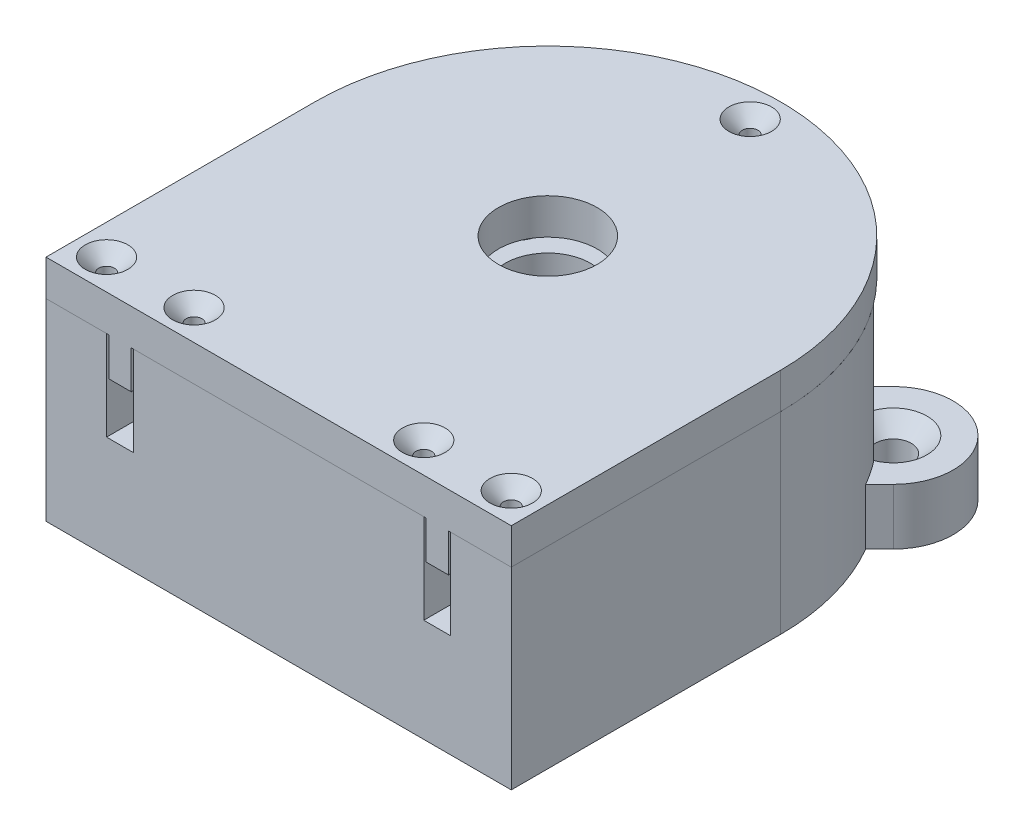
from build123d import *
from build123d.topology import SkipClean

# Parameters (mm, degrees)
BOSS_EXTRUDE1_DEPTH                         = 3.2
SKETCH2_R                                   = 1.25
SKETCH2_R_2                                 = 0.545
BOSS_EXTRUDE2_DEPTH                         = 0.8
BOSS_EXTRUDE2_2_DEPTH                       = 0.8
BOSS_EXTRUDE2_3_DEPTH                       = 0.8
BOSS_EXTRUDE3_START                         = 1
SKETCH4_R                                   = 6.435
BOSS_EXTRUDE3_DEPTH                         = 1
SKETCH5_R                                   = 6.435
BOSS_EXTRUDE4_DEPTH                         = 1
BOSS_EXTRUDE5_START                         = 0.8
SKETCH7_R                                   = 1.25
SKETCH7_R_2                                 = 0.595
BOSS_EXTRUDE5_DEPTH                         = 0.8
BOSS_EXTRUDE6_START                         = -1.5
BOSS_EXTRUDE6_DEPTH                         = 6.1
BOSS_EXTRUDE7_DEPTH                         = 2.5
SKETCH10_R                                  = 10.37
SKETCH10_W                                  = 20.74
SKETCH10_H                                  = 12
BOSS_EXTRUDE8_DEPTH                         = 1.6
CSK_FOR_1_FLAT_HEAD_MACHINE_SCREW_2_COUNT   = 2
CSK_FOR_1_FLAT_HEAD_MACHINE_SCREW_2_PITCH   = 18.04
CSK_FOR_1_FLAT_HEAD_MACHINE_SCREW_3_COUNT   = 2
CSK_FOR_1_FLAT_HEAD_MACHINE_SCREW_3_PITCH   = 14.14
CSK_FOR_1_FLAT_HEAD_MACHINE_SCREW_4_COUNT   = 2
CSK_FOR_1_FLAT_HEAD_MACHINE_SCREW_4_PITCH   = 21.639530956
CSK_FOR_1_FLAT_HEAD_MACHINE_SCREW_5_COUNT   = 2
CSK_FOR_1_FLAT_HEAD_MACHINE_SCREW_5_PITCH   = 3.9
BOSS_EXTRUDE9_DEPTH                         = 2.5
SKETCH26_R                                  = 8.2
CUT_EXTRUDE4_DEPTH                          = 1.5
SKETCH27_R                                  = 2.2
CUT_EXTRUDE5_DEPTH                          = 18.630283605
SKETCH28_R                                  = 1.4
CUT_EXTRUDE6_DEPTH                          = 18.417717991
SKETCH30_R                                  = 6.635
BOSS_EXTRUDE10_DEPTH                        = 2.1
CUT_EXTRUDE3_START                          = -6.1
SKETCH25_R                                  = 1.6
CUT_EXTRUDE3_DEPTH                          = 7.7
CSK_FOR_1_FLAT_HEAD_MACHINE_SCREW_6_A_COUNT = 2
CSK_FOR_1_FLAT_HEAD_MACHINE_SCREW_6_A_PITCH = 7.304924281
CSK_FOR_1_FLAT_HEAD_MACHINE_SCREW_7_COUNT   = 2
CSK_FOR_1_FLAT_HEAD_MACHINE_SCREW_7_PITCH   = 7.304924281
CSK_FOR_1_FLAT_HEAD_MACHINE_SCREW_8_A_COUNT = 2
CSK_FOR_1_FLAT_HEAD_MACHINE_SCREW_8_A_PITCH = 15.4
CSK_FOR_1_FLAT_HEAD_MACHINE_SCREW_9_COUNT   = 2
CSK_FOR_1_FLAT_HEAD_MACHINE_SCREW_9_PITCH   = 21.778888861
CSK_FOR_1_FLAT_HEAD_MACHINE_SCREW_10_COUNT  = 2
CSK_FOR_1_FLAT_HEAD_MACHINE_SCREW_10_PITCH  = 15.4
SKETCH36_R                                  = 7.57
SKETCH36_R_2                                = 6.735
BOSS_EXTRUDE11_DEPTH                        = 1.7
SKETCH37_R                                  = 2.2
CUT_EXTRUDE7_DEPTH                          = 1.6
FILLET1_R                                   = 1


# Read off the part's stored shape, not the designer's step: Boss-Extrude6
with BuildPart() as part:
    # Sketch1 → Boss-Extrude1 (new body)
    with BuildSketch(Plane(origin=(0, 0, 0), x_dir=(1, 0, 0), z_dir=(0, 1, 0))):
        with BuildLine():
            ThreePointArc((-1.284523258, -1.4), (-1.48216338, -1.188777404), (-1.645448267, -0.95))
            Line((-1.645448267, -0.95), (-2.598076211, -1.5))
            ThreePointArc((-2.598076211, -1.5), (-2.379793788, -2.026980386), (-2.305341719, -2.5925))
            ThreePointArc((-2.305341719, -2.5925), (-2.88570421, -4.075525106), (-4.318489055, -4.770731315))
            ThreePointArc((-4.318489055, -4.770731315), (0, -6.435), (4.318489055, -4.770731315))
            ThreePointArc((4.318489055, -4.770731315), (2.556545765, -3.609681503), (2.598076211, -1.5))
            Line((2.598076211, -1.5), (1.645448267, -0.95))
            ThreePointArc((1.645448267, -0.95), (1.48216338, -1.188777404), (1.284523258, -1.4))
            ThreePointArc((1.284523258, -1.4), (0, -1.9), (-1.284523258, -1.4))
        make_face()
        with BuildLine():
            Line((0, 3), (0, 1.9))
            ThreePointArc((0, 1.9), (1.343502884, 1.343502884), (1.9, 0))
            ThreePointArc((1.9, 0), (1.83525907, -0.491756186), (1.645448267, -0.95))
            Line((1.645448267, -0.95), (2.598076211, -1.5))
            ThreePointArc((2.598076211, -1.5), (4.404348764, -0.409192827), (6.290819041, -1.35455557))
            ThreePointArc((6.290819041, -1.35455557), (6.398853238, -0.681103689), (6.435, 0))
            ThreePointArc((6.435, 0), (5.201017615, 3.789279717), (1.972329986, 6.125286885))
            ThreePointArc((1.972329986, 6.125286885), (2.1311694, 5.667018662), (2.185, 5.185))
            ThreePointArc((2.185, 5.185), (1.545028317, 3.639971683), (0, 3))
        make_face()
        with BuildLine():
            ThreePointArc((-1.645448267, -0.95), (-1.645448267, 0.95), (0, 1.9))
            Line((0, 1.9), (0, 3))
            ThreePointArc((0, 3), (-1.847802999, 4.01887433), (-1.972329986, 6.125286885))
            ThreePointArc((-1.972329986, 6.125286885), (-5.572873473, 3.2175), (-6.290819041, -1.35455557))
            ThreePointArc((-6.290819041, -1.35455557), (-4.404348764, -0.409192827), (-2.598076211, -1.5))
            Line((-2.598076211, -1.5), (-1.645448267, -0.95))
        make_face()
        with BuildLine():
            Line((1.284523258, -1.4), (0, -1.4))
            Line((0, -1.4), (-1.284523258, -1.4))
            ThreePointArc((-1.284523258, -1.4), (0, -1.9), (1.284523258, -1.4))
        make_face()
    extrude(amount=BOSS_EXTRUDE1_DEPTH)



with BuildPart() as body_2:
    # Sketch2 → Boss-Extrude2 (new body)
    with BuildSketch(Plane.XZ):
        with Locations(Location((-4.490341719, 2.5925, 0), (0, 0, 270))):
            Circle(SKETCH2_R)
        with Locations(Location((-4.490341719, 2.5925, 0), (0, 0, 270))):
            Circle(SKETCH2_R_2, mode=Mode.SUBTRACT)
    extrude(amount=-BOSS_EXTRUDE2_DEPTH)


with BuildPart() as body_3:
    # Sketch2 → Boss-Extrude2 2 (new body)
    with BuildSketch(Plane.XZ):
        with Locations(Location((4.490341719, 2.5925, 0), (0, 0, 270))):
            Circle(SKETCH2_R)
        with Locations(Location((4.490341719, 2.5925, 0), (0, 0, 270))):
            Circle(SKETCH2_R_2, mode=Mode.SUBTRACT)
    extrude(amount=-BOSS_EXTRUDE2_2_DEPTH)


with BuildPart() as body_4:
    # Sketch2 → Boss-Extrude2 3 (new body)
    with BuildSketch(Plane.XZ):
        with Locations(Location((0, -5.185, 0), (0, 0, 270))):
            Circle(SKETCH2_R)
        with Locations(Location((0, -5.185, 0), (0, 0, 270))):
            Circle(SKETCH2_R_2, mode=Mode.SUBTRACT)
    extrude(amount=-BOSS_EXTRUDE2_3_DEPTH)


with BuildPart() as part_1:
    with SkipClean():  # the faces are left unmerged after this step: merging them gives an invalid solid
        add(part.part)

        add(body_2.part)  # Boss-Extrude3 merges body 2

        add(body_3.part)  # Boss-Extrude3 merges body 3

        add(body_4.part)  # Boss-Extrude3 merges body 4
        # Sketch4 → Boss-Extrude3 (add)
        with BuildSketch(Plane.XZ.offset(BOSS_EXTRUDE3_START)):
            with Locations(Location((0, 0, 0), (0, 0, 270))):
                Circle(SKETCH4_R)
        extrude(amount=-BOSS_EXTRUDE3_DEPTH)


with BuildPart() as body_2_2:
    # Sketch5 → Boss-Extrude4 (new body)
    with BuildSketch(Plane(origin=(0, 3.2, 0), x_dir=(1, 0, 0), z_dir=(0, 1, 0))):
        with Locations(Location((0, 0, 0), (0, 0, 270))):
            Circle(SKETCH5_R)
    extrude(amount=BOSS_EXTRUDE4_DEPTH)

    # Sketch7 → Boss-Extrude5 (add)
    # profile 1 of 3: a face of its own
    with BuildSketch(Plane.XZ.offset(-3.2).offset(BOSS_EXTRUDE5_START)):
        with Locations(Location((0, -5.185, 0), (0, 0, 270))):
            Circle(SKETCH7_R)
        with Locations(Location((0, -5.185, 0), (0, 0, 270))):
            Circle(SKETCH7_R_2, mode=Mode.SUBTRACT)
    # profile 2 of 3: a face of its own
    with BuildSketch(Plane.XZ.offset(-3.2).offset(BOSS_EXTRUDE5_START)):
        with Locations(Location((-4.490341719, 2.5925, 0), (0, 0, 149.999192618))):
            Circle(SKETCH7_R)
        with Locations(Location((-4.490341719, 2.5925, 0), (0, 0, 270))):
            Circle(SKETCH7_R_2, mode=Mode.SUBTRACT)
    # profile 3 of 3: a face of its own
    with BuildSketch(Plane.XZ.offset(-3.2).offset(BOSS_EXTRUDE5_START)):
        with Locations(Location((4.490341719, 2.5925, 0), (0, 0, 29.999192618))):
            Circle(SKETCH7_R)
        with Locations(Location((4.490341719, 2.5925, 0), (0, 0, 270))):
            Circle(SKETCH7_R_2, mode=Mode.SUBTRACT)
    extrude(amount=-BOSS_EXTRUDE5_DEPTH)


with BuildPart() as body_3_2:
    # Boss-Extrude6 outline → Boss-Extrude6 (new body)
    with BuildSketch(Plane(origin=(0, 0, 0), x_dir=(1, 0, 0), z_dir=(0, 1, 0)).offset(BOSS_EXTRUDE6_START)):
        with BuildLine():
            Line((-10.37, -12), (-7.67, -12))
            Line((-7.67, -12), (-7.67, 0))
            ThreePointArc((-7.67, 0), (0, 7.67), (7.67, 0))
            Line((7.67, 0), (7.67, -12))
            Line((7.67, -12), (10.37, -12))
            Line((10.37, -12), (10.37, 0))
            ThreePointArc((10.37, 0), (0, 10.37), (-10.37, 0))
            Line((-10.37, 0), (-10.37, -12))
        make_face()
        with BuildLine():
            Line((6.47, -12), (6.47, -4.119223228))
            ThreePointArc((6.47, -4.119223228), (0, -7.67), (-6.47, -4.119223228))
            Line((-6.47, -4.119223228), (-6.47, -12))
            Line((-6.47, -12), (6.47, -12))
        make_face()
    extrude(amount=BOSS_EXTRUDE6_DEPTH)

    # Sketch9 → Boss-Extrude7 (add)
    with BuildSketch(Plane(origin=(0, -1.5, 0), x_dir=(1, 0, 0), z_dir=(0, 1, 0))):
        with BuildLine():
            Line((-10.37, -12), (10.37, -12))
            Line((10.37, -12), (10.37, 0))
            ThreePointArc((10.37, 0), (0, 10.37), (-10.37, 0))
            Line((-10.37, 0), (-10.37, -12))
        make_face()
    extrude(amount=-BOSS_EXTRUDE7_DEPTH)


with BuildPart() as body_4_2:
    # Sketch10 → Boss-Extrude8 (new body)
    with BuildSketch(Plane(origin=(0, 4.6, 0), x_dir=(1, 0, 0), z_dir=(0, 1, 0))):
        Circle(SKETCH10_R)
        with Locations((0, -6)):
            Rectangle(SKETCH10_W, SKETCH10_H)
    extrude(amount=BOSS_EXTRUDE8_DEPTH)


with BuildPart() as csk_for_1_flat_head_machine_screw_100_tool:
    # Sketch22 → CSK for _1 Flat Head Machine Screw _100 (revolve)
    with BuildSketch(Plane(origin=(9.02, 6.2, 10.65), x_dir=(0, 0, 1), z_dir=(1, 0, 0))):
        Polygon((0, 0), (0, 3.1), (0.34925, 3.1), (0.34925, 0.60071), (0.94996, 0), align=None)
    csk_for_1_flat_head_machine_screw_100 = revolve(axis=Axis((9.02, 12.55, 10.65), (0, -1, 0)))


with BuildPart() as body_3_2_1:
    add(body_3_2.part)

    # CSK for _1 Flat Head Machine Screw _100: cut by csk_for_1_flat_head_machine_screw_100_tool
    add(csk_for_1_flat_head_machine_screw_100_tool.part, mode=Mode.SUBTRACT)


with BuildPart() as body_4_2_1:
    add(body_4_2.part)

    # CSK for _1 Flat Head Machine Screw _100: cut by csk_for_1_flat_head_machine_screw_100_tool
    add(csk_for_1_flat_head_machine_screw_100_tool.part, mode=Mode.SUBTRACT)


with BuildPart() as csk_for_1_flat_head_machine_screw_2_tool:
    # CSK for _1 Flat Head Machine Screw _ 2: CSK for _1 Flat Head Machine Screw _100 ×2
    with Locations(*[(-i * CSK_FOR_1_FLAT_HEAD_MACHINE_SCREW_2_PITCH, 0, 0) for i in range(1, CSK_FOR_1_FLAT_HEAD_MACHINE_SCREW_2_COUNT)]):
        add(csk_for_1_flat_head_machine_screw_100)


with BuildPart() as body_3_2_2:
    add(body_3_2_1.part)

    # CSK for _1 Flat Head Machine Screw _ 2: cut by csk_for_1_flat_head_machine_screw_2_tool
    add(csk_for_1_flat_head_machine_screw_2_tool.part, mode=Mode.SUBTRACT)


with BuildPart() as body_4_2_2:
    add(body_4_2_1.part)

    # CSK for _1 Flat Head Machine Screw _ 2: cut by csk_for_1_flat_head_machine_screw_2_tool
    add(csk_for_1_flat_head_machine_screw_2_tool.part, mode=Mode.SUBTRACT)


with BuildPart() as csk_for_1_flat_head_machine_screw_3_tool:
    # CSK for _1 Flat Head Machine Screw _ 3: CSK for _1 Flat Head Machine Screw _100 ×2
    with Locations(*[(-i * CSK_FOR_1_FLAT_HEAD_MACHINE_SCREW_3_PITCH, 0, 0) for i in range(1, CSK_FOR_1_FLAT_HEAD_MACHINE_SCREW_3_COUNT)]):
        add(csk_for_1_flat_head_machine_screw_100)


with BuildPart() as body_3_2_3:
    add(body_3_2_2.part)

    # CSK for _1 Flat Head Machine Screw _ 3: cut by csk_for_1_flat_head_machine_screw_3_tool
    add(csk_for_1_flat_head_machine_screw_3_tool.part, mode=Mode.SUBTRACT)


with BuildPart() as body_4_2_3:
    add(body_4_2_2.part)

    # CSK for _1 Flat Head Machine Screw _ 3: cut by csk_for_1_flat_head_machine_screw_3_tool
    add(csk_for_1_flat_head_machine_screw_3_tool.part, mode=Mode.SUBTRACT)


with BuildPart() as csk_for_1_flat_head_machine_screw_4_tool:
    # CSK for _1 Flat Head Machine Screw _ 4: CSK for _1 Flat Head Machine Screw _100 ×2
    with Locations(*[Vector(-0.4168297371278021, 0, -0.9089845819627347) * (i * CSK_FOR_1_FLAT_HEAD_MACHINE_SCREW_4_PITCH) for i in range(1, CSK_FOR_1_FLAT_HEAD_MACHINE_SCREW_4_COUNT)]):
        add(csk_for_1_flat_head_machine_screw_100)


with BuildPart() as body_3_2_4:
    add(body_3_2_3.part)

    # CSK for _1 Flat Head Machine Screw _ 4: cut by csk_for_1_flat_head_machine_screw_4_tool
    add(csk_for_1_flat_head_machine_screw_4_tool.part, mode=Mode.SUBTRACT)


with BuildPart() as body_4_2_4:
    add(body_4_2_3.part)

    # CSK for _1 Flat Head Machine Screw _ 4: cut by csk_for_1_flat_head_machine_screw_4_tool
    add(csk_for_1_flat_head_machine_screw_4_tool.part, mode=Mode.SUBTRACT)


with BuildPart() as csk_for_1_flat_head_machine_screw_5_tool:
    # CSK for _1 Flat Head Machine Screw _ 5: CSK for _1 Flat Head Machine Screw _100 ×2
    with Locations(*[(-i * CSK_FOR_1_FLAT_HEAD_MACHINE_SCREW_5_PITCH, 0, 0) for i in range(1, CSK_FOR_1_FLAT_HEAD_MACHINE_SCREW_5_COUNT)]):
        add(csk_for_1_flat_head_machine_screw_100)


with BuildPart() as body_3_2_5:
    add(body_3_2_4.part)

    # CSK for _1 Flat Head Machine Screw _ 5: cut by csk_for_1_flat_head_machine_screw_5_tool
    add(csk_for_1_flat_head_machine_screw_5_tool.part, mode=Mode.SUBTRACT)

    # Sketch24 → Boss-Extrude9 (add)
    with BuildSketch(Plane.XZ.offset(4)):
        with BuildLine():
            ThreePointArc((-8.903418523, -5.316581477), (-9.265421569, -5.537049397), (-9.587975106, -5.812024894))
            Line((-9.587975106, -5.812024894), (-5.812024894, -9.587975106))
            ThreePointArc((-5.812024894, -9.587975106), (-5.537049397, -9.265421569), (-5.316581477, -8.903418523))
            ThreePointArc((-5.316581477, -8.903418523), (-7.332697321, -7.332697321), (-8.903418523, -5.316581477))
        make_face()
        with BuildLine():
            Line((-8.973453212, -5.197503001), (-9.587975106, -5.812024894))
            ThreePointArc((-9.587975106, -5.812024894), (-9.265421569, -5.537049397), (-8.903418523, -5.316581477))
            ThreePointArc((-8.903418523, -5.316581477), (-8.938634162, -5.257158863), (-8.973453212, -5.197503001))
        make_face()
        with BuildLine():
            ThreePointArc((-5.316581477, -8.903418523), (-5.537049397, -9.265421569), (-5.812024894, -9.587975106))
            Line((-5.812024894, -9.587975106), (-5.197503001, -8.973453212))
            ThreePointArc((-5.197503001, -8.973453212), (-5.257158863, -8.938634162), (-5.316581477, -8.903418523))
        make_face()
        with BuildLine():
            Line((-5.812024894, -9.587975106), (-9.587975106, -5.812024894))
            ThreePointArc((-9.587975106, -5.812024894), (-9.587975106, -9.587975106), (-5.812024894, -9.587975106))
        make_face()
        with BuildLine():
            ThreePointArc((8.903418523, -5.316581477), (9.265421569, -5.537049397), (9.587975106, -5.812024894))
            Line((9.587975106, -5.812024894), (8.973453212, -5.197503001))
            ThreePointArc((8.973453212, -5.197503001), (8.938634162, -5.257158863), (8.903418523, -5.316581477))
        make_face()
        with BuildLine():
            ThreePointArc((5.316581477, -8.903418523), (5.537049397, -9.265421569), (5.812024894, -9.587975106))
            Line((5.812024894, -9.587975106), (9.587975106, -5.812024894))
            ThreePointArc((9.587975106, -5.812024894), (9.265421569, -5.537049397), (8.903418523, -5.316581477))
            ThreePointArc((8.903418523, -5.316581477), (7.332697321, -7.332697321), (5.316581477, -8.903418523))
        make_face()
        with BuildLine():
            ThreePointArc((5.316581477, -8.903418523), (5.257158863, -8.938634162), (5.197503001, -8.973453212))
            Line((5.197503001, -8.973453212), (5.812024894, -9.587975106))
            ThreePointArc((5.812024894, -9.587975106), (5.537049397, -9.265421569), (5.316581477, -8.903418523))
        make_face()
        with BuildLine():
            Line((9.587975106, -5.812024894), (5.812024894, -9.587975106))
            ThreePointArc((5.812024894, -9.587975106), (8.721764764, -10.166758352), (10.37, -7.7))
            ThreePointArc((10.37, -7.7), (10.166758352, -6.678235236), (9.587975106, -5.812024894))
        make_face()
    extrude(amount=-BOSS_EXTRUDE9_DEPTH)

    # Sketch26 → Cut-Extrude4 (cut)
    with BuildSketch(Plane.XZ.offset(4)):
        with Locations(Location((0, 0, 0), (0, 0, 270))):
            Circle(SKETCH26_R)
    extrude(amount=-CUT_EXTRUDE4_DEPTH, mode=Mode.SUBTRACT)

    # Sketch27 → Cut-Extrude5 (cut, through all)
    with BuildSketch(Plane(origin=(0, -1.5, 0), x_dir=(1, 0, 0), z_dir=(0, 1, 0))):
        with Locations(Location((0, 0, 0), (0, 0, 270))):
            Circle(SKETCH27_R)
    extrude(amount=-CUT_EXTRUDE5_DEPTH, mode=Mode.SUBTRACT)

    # Sketch30 → Boss-Extrude10 (add)
    # profile 1 of 3: a face of its own
    with BuildSketch(Plane(origin=(0, -1.5, 0), x_dir=(1, 0, 0), z_dir=(0, 1, 0))):
        with BuildLine():
            ThreePointArc((-6.47, -4.119223228), (-7.363891634, -2.145227261), (-7.67, 0))
            Line((-7.67, 0), (-7.67, -12))
            Line((-7.67, -12), (-6.47, -12))
            Line((-6.47, -12), (-6.47, -4.119223228))
        make_face()
    # profile 2 of 3: a face of its own
    with BuildSketch(Plane(origin=(0, -1.5, 0), x_dir=(1, 0, 0), z_dir=(0, 1, 0))):
        with BuildLine():
            ThreePointArc((7.67, 0), (0, 7.67), (-7.67, 0))
            ThreePointArc((-7.67, 0), (-7.363891634, -2.145227261), (-6.47, -4.119223228))
            ThreePointArc((-6.47, -4.119223228), (0, -7.67), (6.47, -4.119223228))
            ThreePointArc((6.47, -4.119223228), (7.363891634, -2.145227261), (7.67, 0))
        make_face()
        with Locations(Location((0, 0, 0), (0, 0, 270))):
            Circle(SKETCH30_R, mode=Mode.SUBTRACT)
    # profile 3 of 3: a face of its own
    with BuildSketch(Plane(origin=(0, -1.5, 0), x_dir=(1, 0, 0), z_dir=(0, 1, 0))):
        with BuildLine():
            Line((7.67, -12), (7.67, 0))
            ThreePointArc((7.67, 0), (7.363891634, -2.145227261), (6.47, -4.119223228))
            Line((6.47, -4.119223228), (6.47, -12))
            Line((6.47, -12), (7.67, -12))
        make_face()
    extrude(amount=BOSS_EXTRUDE10_DEPTH)

    # Sketch25 → Cut-Extrude3 (cut)
    with BuildSketch(Plane(origin=(0, 4.6, 0), x_dir=(1, 0, 0), z_dir=(0, 1, 0)).offset(CUT_EXTRUDE3_START)):
        with Locations((-7.7, 7.7)):
            Circle(SKETCH25_R)
        with Locations((7.7, 7.7)):
            Circle(SKETCH25_R)
        with Locations(Location((7.7, -7.7, 0), (0, 0, 270))):
            Circle(SKETCH25_R)
        with Locations(Location((-7.7, -7.7, 0), (0, 0, 270))):
            Circle(SKETCH25_R)
    extrude(amount=CUT_EXTRUDE3_DEPTH, mode=Mode.SUBTRACT)

    # Sketch34 → CSK for _1 Flat Head Machine Screw _ 8 (revolve, cut)
    with BuildSketch(Plane(origin=(-7.7, -1.5, 7.7), x_dir=(0, 0, 1), z_dir=(1, 0, 0))):
        Polygon((0, 0), (0, 4.1), (0.800000051, 4.1), (0.800000051, 0.699999489), (1.49999954, 0), align=None)
    csk_for_1_flat_head_machine_screw_8 = revolve(axis=Axis((-7.7, 4.85, 7.7), (0, -1, 0)), mode=Mode.SUBTRACT)

    # CSK for _1 Flat Head Machine Screw _ 8 a: CSK for _1 Flat Head Machine Screw _ 8 ×2
    with Locations(*[(0, 0, -i * CSK_FOR_1_FLAT_HEAD_MACHINE_SCREW_8_A_PITCH) for i in range(1, CSK_FOR_1_FLAT_HEAD_MACHINE_SCREW_8_A_COUNT)]):
        add(csk_for_1_flat_head_machine_screw_8, mode=Mode.SUBTRACT)

    # CSK for _1 Flat Head Machine Screw _ 9: CSK for _1 Flat Head Machine Screw _ 8 ×2
    with Locations(*[Vector(0.7071067811865476, 0, -0.7071067811865476) * (i * CSK_FOR_1_FLAT_HEAD_MACHINE_SCREW_9_PITCH) for i in range(1, CSK_FOR_1_FLAT_HEAD_MACHINE_SCREW_9_COUNT)]):
        add(csk_for_1_flat_head_machine_screw_8, mode=Mode.SUBTRACT)

    # CSK for _1 Flat Head Machine Screw _ 10: CSK for _1 Flat Head Machine Screw _ 8 ×2
    with Locations(*[(i * CSK_FOR_1_FLAT_HEAD_MACHINE_SCREW_10_PITCH, 0, 0) for i in range(1, CSK_FOR_1_FLAT_HEAD_MACHINE_SCREW_10_COUNT)]):
        add(csk_for_1_flat_head_machine_screw_8, mode=Mode.SUBTRACT)

    # Fillet1
    # the kernel refuses this fillet: 1 mm, written as the material it takes off along each edge
    with BuildSketch(Plane(origin=(6.47, 0.6, 4.119223228), x_dir=(0, 0, 1), z_dir=(0, 1, 0))) as fillet1_piece_1:
        with BuildLine():
            CenterArc((2.606464472, -0.99880041), FILLET1_R, 92.806710124, 126.320888755)
            Line((1.830721946, -1.629849959), (1.815207096, -1.64247095))
            ThreePointArc((1.815207096, -1.64247095), (0.967589756, -0.756259223), (-0.01074113, -0.016870926))
            Line((-0.01074113, -0.016870926), (0, 0.02))
            ThreePointArc((0, 0.02), (1.278748864, 0.02), (2.556518394, 0.019976008))
            Line((2.556518394, 0.019976008), (2.557497729, 0))
        make_face()
    extrude(amount=10.393744322, mode=Mode.SUBTRACT)
    with BuildSketch(Plane(origin=(-6.47, 0.6, 4.119223228), x_dir=(0, 0, 1), z_dir=(0, 1, 0))) as fillet1_piece_2:
        with BuildLine():
            CenterArc((2.606464472, 0.99880041), FILLET1_R, 140.872401121, 126.320888755)
            Line((1.830721946, 1.629849959), (1.815207096, 1.64247095))
            ThreePointArc((1.815207096, 1.64247095), (0.967589756, 0.756259223), (-0.01074113, 0.016870926))
            Line((-0.01074113, 0.016870926), (0, -0.02))
            ThreePointArc((0, -0.02), (1.278748864, -0.02), (2.556518394, -0.019976008))
            Line((2.556518394, -0.019976008), (2.557497729, 0))
        make_face()
    extrude(amount=10.393744322, mode=Mode.SUBTRACT)


with BuildPart() as body_4_2_5:
    add(body_4_2_4.part)

    # CSK for _1 Flat Head Machine Screw _ 5: cut by csk_for_1_flat_head_machine_screw_5_tool
    add(csk_for_1_flat_head_machine_screw_5_tool.part, mode=Mode.SUBTRACT)


with BuildPart() as cut_extrude6_tool:
    # Sketch28 → Cut-Extrude6 (new, through all)
    # profile 1 of 2: a face of its own
    with SkipClean():  # the faces are left unmerged after this step: merging them gives an invalid solid
        with BuildSketch(Plane.XZ.offset(1)):
            with BuildLine():
                Line((0, 1.4), (-1.284523258, 1.4))
                ThreePointArc((-1.284523258, 1.4), (-0.764658685, -1.73933812), (1.9, 0))
                ThreePointArc((1.9, 0), (1.73933812, 0.764658685), (1.284523258, 1.4))
                Line((1.284523258, 1.4), (0, 1.4))
            make_face()
            with BuildLine():
                ThreePointArc((1.4, 0), (-0.989949494, -0.989949494), (0, 1.4))
                ThreePointArc((0, 1.4), (0.989949494, 0.989949494), (1.4, 0))
            make_face(mode=Mode.SUBTRACT)
        # profile 2 of 2: a face of its own
        with BuildSketch(Plane.XZ.offset(1)):
            Circle(SKETCH28_R)
        extrude(amount=-CUT_EXTRUDE6_DEPTH)


with BuildPart() as part_2:
    with SkipClean():  # the faces are left unmerged after this step: merging them gives an invalid solid
        add(part_1.part)

        # Cut-Extrude6: cut by cut_extrude6_tool
        add(cut_extrude6_tool.part, mode=Mode.SUBTRACT)


with BuildPart() as body_2_2_1:
    with SkipClean():  # the faces are left unmerged after this step: merging them gives an invalid solid
        add(body_2_2.part)

        # Cut-Extrude6: cut by cut_extrude6_tool
        add(cut_extrude6_tool.part, mode=Mode.SUBTRACT)


with BuildPart() as body_4_2_6:
    with SkipClean():  # the faces are left unmerged after this step: merging them gives an invalid solid
        add(body_4_2_5.part)

        # Cut-Extrude6: cut by cut_extrude6_tool
        add(cut_extrude6_tool.part, mode=Mode.SUBTRACT)

    # Sketch36 → Boss-Extrude11 (add)
    # profile 1 of 3: a face of its own
    with BuildSketch(Plane.XZ.offset(-4.6)):
        with BuildLine():
            Line((-7.57, 12), (-7.57, 0))
            ThreePointArc((-7.57, 0), (-7.315729629, 1.945507646), (-6.57, 3.760319135))
            Line((-6.57, 3.760319135), (-6.57, 12))
            Line((-6.57, 12), (-7.57, 12))
        make_face()
    # profile 2 of 3: a face of its own
    with BuildSketch(Plane.XZ.offset(-4.6)):
        Circle(SKETCH36_R)
        with Locations(Location((0, 0, 0), (0, 0, 270))):
            Circle(SKETCH36_R_2, mode=Mode.SUBTRACT)
    # profile 3 of 3: a face of its own
    with BuildSketch(Plane.XZ.offset(-4.6)):
        with BuildLine():
            ThreePointArc((6.57, 3.760319135), (7.315729629, 1.945507646), (7.57, 0))
            Line((7.57, 0), (7.57, 12))
            Line((7.57, 12), (6.57, 12))
            Line((6.57, 12), (6.57, 3.760319135))
        make_face()
    extrude(amount=BOSS_EXTRUDE11_DEPTH)

    # Sketch37 → Cut-Extrude7 (cut)
    with BuildSketch(Plane(origin=(0, 6.2, 0), x_dir=(1, 0, 0), z_dir=(0, 1, 0))):
        with Locations(Location((0, 0, 0), (0, 0, 270))):
            Circle(SKETCH37_R)
    extrude(amount=-CUT_EXTRUDE7_DEPTH, mode=Mode.SUBTRACT)


with BuildPart() as csk_for_1_flat_head_machine_screw_6_tool:
    # Sketch32 → CSK for _1 Flat Head Machine Screw _ 6 (revolve)
    with SkipClean():  # the faces are left unmerged after this step: merging them gives an invalid solid
        with BuildSketch(Plane(origin=(0, 4.2, 4.2175), x_dir=(0, 0, 1), z_dir=(1, 0, 0))):
            Polygon((0, 0), (0, 4.1), (0.800000051, 4.1), (0.800000051, 0.699999489), (1.49999954, 0), align=None)
        csk_for_1_flat_head_machine_screw_6 = revolve(axis=Axis((0, 10.55, 4.2175), (0, -1, 0)))


with BuildPart() as part_3:
    with SkipClean():  # the faces are left unmerged after this step: merging them gives an invalid solid
        add(part_2.part)

        # CSK for _1 Flat Head Machine Screw _ 6: cut by csk_for_1_flat_head_machine_screw_6_tool
        add(csk_for_1_flat_head_machine_screw_6_tool.part, mode=Mode.SUBTRACT)


with BuildPart() as body_2_2_2:
    with SkipClean():  # the faces are left unmerged after this step: merging them gives an invalid solid
        add(body_2_2_1.part)

        # CSK for _1 Flat Head Machine Screw _ 6: cut by csk_for_1_flat_head_machine_screw_6_tool
        add(csk_for_1_flat_head_machine_screw_6_tool.part, mode=Mode.SUBTRACT)


with BuildPart() as csk_for_1_flat_head_machine_screw_6_a_tool:
    # CSK for _1 Flat Head Machine Screw _ 6 a: CSK for _1 Flat Head Machine Screw _ 6 ×2
    with SkipClean():  # the faces are left unmerged after this step: merging them gives an invalid solid
        with Locations(*[Vector(-0.49999999999999806, 0, -0.8660254037844398) * (i * CSK_FOR_1_FLAT_HEAD_MACHINE_SCREW_6_A_PITCH) for i in range(1, CSK_FOR_1_FLAT_HEAD_MACHINE_SCREW_6_A_COUNT)]):
            add(csk_for_1_flat_head_machine_screw_6)


with BuildPart() as part_4:
    with SkipClean():  # the faces are left unmerged after this step: merging them gives an invalid solid
        add(part_3.part)

        # CSK for _1 Flat Head Machine Screw _ 6 a: cut by csk_for_1_flat_head_machine_screw_6_a_tool
        add(csk_for_1_flat_head_machine_screw_6_a_tool.part, mode=Mode.SUBTRACT)


with BuildPart() as body_2_2_3:
    with SkipClean():  # the faces are left unmerged after this step: merging them gives an invalid solid
        add(body_2_2_2.part)

        # CSK for _1 Flat Head Machine Screw _ 6 a: cut by csk_for_1_flat_head_machine_screw_6_a_tool
        add(csk_for_1_flat_head_machine_screw_6_a_tool.part, mode=Mode.SUBTRACT)


with BuildPart() as csk_for_1_flat_head_machine_screw_7_tool:
    # CSK for _1 Flat Head Machine Screw _ 7: CSK for _1 Flat Head Machine Screw _ 6 ×2
    with SkipClean():  # the faces are left unmerged after this step: merging them gives an invalid solid
        with Locations(*[Vector(0.49999999999999784, 0, -0.8660254037844399) * (i * CSK_FOR_1_FLAT_HEAD_MACHINE_SCREW_7_PITCH) for i in range(1, CSK_FOR_1_FLAT_HEAD_MACHINE_SCREW_7_COUNT)]):
            add(csk_for_1_flat_head_machine_screw_6)


with BuildPart() as part_5:
    with SkipClean():  # the faces are left unmerged after this step: merging them gives an invalid solid
        add(part_4.part)

        # CSK for _1 Flat Head Machine Screw _ 7: cut by csk_for_1_flat_head_machine_screw_7_tool
        add(csk_for_1_flat_head_machine_screw_7_tool.part, mode=Mode.SUBTRACT)


with BuildPart() as body_2_2_4:
    with SkipClean():  # the faces are left unmerged after this step: merging them gives an invalid solid
        add(body_2_2_3.part)

        # CSK for _1 Flat Head Machine Screw _ 7: cut by csk_for_1_flat_head_machine_screw_7_tool
        add(csk_for_1_flat_head_machine_screw_7_tool.part, mode=Mode.SUBTRACT)


solid = Compound([body_3_2_5.part, body_4_2_6.part, part_5.part, body_2_2_4.part])
